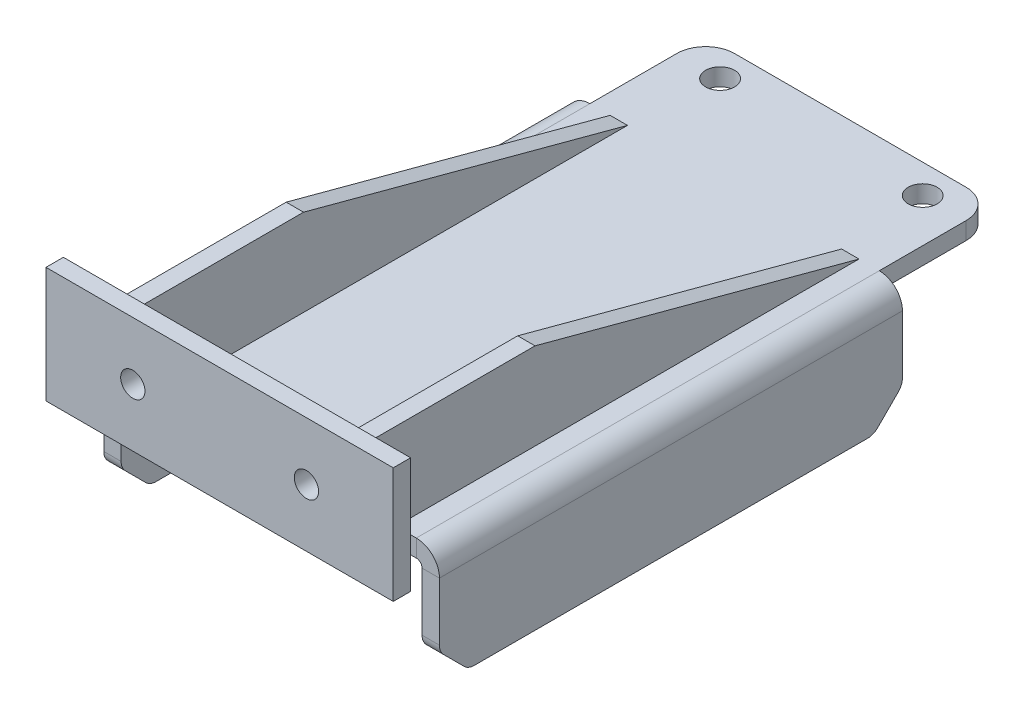
from build123d import *

# Parameters (mm, degrees)
ESBO_O1_W                 = 90
ESBO_O1_H                 = 100
RESSALTO_EXTRUS_O1_DEPTH  = 3
ESBO_O4_W                 = 20
ESBO_O4_H                 = 20
CORTE_EXTRUS_O1_DEPTH     = 3
DOBRA_START               = -30
DOBRA_ESBO_ADA1_DEPTH     = 80
DOBRA_ESBO_ADA1_2_DEPTH   = 80
DOBRA_ESBO_ADA2_DEPTH     = 80
DOBRA_ESBO_ADA2_2_DEPTH   = 80
FILETE1_R                 = 5
CHANFRO1_SIZE             = 5
FILETE2_R                 = 2.5
ESBO_O7_R                 = 2.5
CORTE_EXTRUS_O2_DEPTH     = 3
RESSALTO_EXTRUS_O2_DEPTH  = 21.5
ESBO_O9_W                 = 37
ESBO_O9_H                 = 15
CORTE_EXTRUS_O7_DEPTH     = 90
ESBO_O10_W                = 3
ESBO_O10_H                = 20
RESSALTO_EXTRUS_O3_DEPTH  = 30
FURO_ROSCADO_DE_M51_D     = 4.2
FURO_ROSCADO_DE_M51_DEPTH = 14
FURO_ROSCADO_DE_M51_TIP   = 1.2618073


# Read off the part's stored shape, not the designer's step: Dobra esboçada1, Dobra esboçada2
with BuildPart() as part:
    # Esboço1 → Ressalto-extrusão1 (new body)
    with BuildSketch(Plane(origin=(0, 0, 0), x_dir=(1, 0, 0), z_dir=(0, 1, 0))):
        Rectangle(ESBO_O1_W, ESBO_O1_H)
    extrude(amount=RESSALTO_EXTRUS_O1_DEPTH)

    # Esboço4 → Corte-extrusão1 (cut)
    with BuildSketch(Plane(origin=(0, 3, 0), x_dir=(1, 0, 0), z_dir=(0, 1, 0))):
        with Locations((-35, 40)):
            Rectangle(ESBO_O4_W, ESBO_O4_H)
        with Locations((35, 40)):
            Rectangle(ESBO_O4_W, ESBO_O4_H)
    extrude(amount=-CORTE_EXTRUS_O1_DEPTH, mode=Mode.SUBTRACT)

    # Dobra esboçada1 outline → Dobra esboçada1 (cut)
    with BuildSketch(Plane.XY.offset(DOBRA_START)):
        with BuildLine():
            Line((-45, 0), (-28.872983346, 0))
            ThreePointArc((-28.872983346, 0), (-27.449489743, 2.16227766), (-25, 3))
            Line((-25, 3), (-45, 3))
            Line((-45, 3), (-45, 0))
        make_face()
    extrude(amount=DOBRA_ESBO_ADA1_DEPTH, mode=Mode.SUBTRACT)

    # Dobra esbo_ada1 2 outline → Dobra esbo_ada1 2 (add)
    with BuildSketch(Plane.XY.offset(DOBRA_START)):
        with BuildLine():
            ThreePointArc((-28.872983346, 0), (-28.968118785, -0.49598283), (-29, -1))
            Line((-29, -1), (-29, -17.073009183))
            Line((-29, -17.073009183), (-26, -17.073009183))
            Line((-26, -17.073009183), (-26, -1))
            ThreePointArc((-26, -1), (-25.707106781, -0.292893219), (-25, 0))
            Line((-25, 0), (-28.872983346, 0))
        make_face()
    extrude(amount=DOBRA_ESBO_ADA1_2_DEPTH)

    # Dobra esboçada2 outline → Dobra esboçada2 (cut)
    with BuildSketch(Plane.XY.offset(DOBRA_START)):
        with BuildLine():
            ThreePointArc((25, 3), (27.449489743, 2.16227766), (28.872983346, 0))
            Line((28.872983346, 0), (45, 0))
            Line((45, 0), (45, 3))
            Line((45, 3), (25, 3))
        make_face()
    extrude(amount=DOBRA_ESBO_ADA2_DEPTH, mode=Mode.SUBTRACT)

    # Dobra esbo_ada2 2 outline → Dobra esbo_ada2 2 (add)
    with BuildSketch(Plane.XY.offset(DOBRA_START)):
        with BuildLine():
            Line((26, -1), (26, -17.073009183))
            Line((26, -17.073009183), (29, -17.073009183))
            Line((29, -17.073009183), (29, -1))
            ThreePointArc((29, -1), (28.968118785, -0.49598283), (28.872983346, 0))
            Line((28.872983346, 0), (25, 0))
            ThreePointArc((25, 0), (25.707106781, -0.292893219), (26, -1))
        make_face()
    extrude(amount=DOBRA_ESBO_ADA2_2_DEPTH)

    # Filete1
    filete1_edges = [part.edges().sort_by_distance(p)[0] for p in [
        (-25, 1.5, -50),
        (25, 1.5, -50),
    ]]
    fillet(filete1_edges, radius=FILETE1_R)

    # Chanfro1
    chanfro1_edges = [part.edges().sort_by_distance(p)[0] for p in [
        (27.5, -17.073009183, -30),
        (27.5, -17.073009183, 50),
        (-27.5, -17.073009183, -30),
        (-27.5, -17.073009183, 50),
    ]]
    chamfer(chanfro1_edges, length=CHANFRO1_SIZE)

    # Filete2
    filete2_edges = [part.edges().sort_by_distance(p)[0] for p in [
        (27.5, -12.073009183, 50),
        (27.5, -17.073009183, -25),
        (27.5, -17.073009183, 45),
        (-27.5, -17.073009183, -25),
        (-27.5, -17.073009183, 45),
        (-27.5, -12.073009183, 50),
        (27.5, -12.073009183, -30),
        (-27.5, -12.073009183, -30),
    ]]
    fillet(filete2_edges, radius=FILETE2_R)

    # Esboço7 → Corte-extrusão2 (cut)
    with BuildSketch(Plane(origin=(0, 3, 0), x_dir=(1, 0, 0), z_dir=(0, 1, 0))):
        with Locations(Location((-17.5, 45, 0), (0, 0, 270))):
            Circle(ESBO_O7_R)
        with Locations(Location((17.5, 45, 0), (0, 0, 270))):
            Circle(ESBO_O7_R)
    extrude(amount=-CORTE_EXTRUS_O2_DEPTH, mode=Mode.SUBTRACT)

    # Esboço8 → Ressalto-extrusão2 (add, symmetric)
    with BuildSketch(Plane(origin=(0, 0, 0), x_dir=(0, 0, -1), z_dir=(1, 0, 0))):
        Polygon((30, 3), (-25.980762114, 18), (-55.980762114, 18), (-55.980762114, 3), align=None)
    extrude(amount=RESSALTO_EXTRUS_O2_DEPTH, both=True)

    # Esboço9 → Corte-extrusão7 (cut)
    with BuildSketch(Plane.XY.offset(55.980762114)):
        with Locations((0, 10.5)):
            Rectangle(ESBO_O9_W, ESBO_O9_H)
    extrude(amount=-CORTE_EXTRUS_O7_DEPTH, mode=Mode.SUBTRACT)

    # Esboço10 → Ressalto-extrusão3 (add, symmetric)
    with BuildSketch(Plane(origin=(0, 0, 0), x_dir=(0, 0, -1), z_dir=(1, 0, 0))):
        with Locations((-57.480762114, 10.5)):
            Rectangle(ESBO_O10_W, ESBO_O10_H)
    extrude(amount=RESSALTO_EXTRUS_O3_DEPTH, both=True)

    # Furo roscado de M51
    with Locations(Plane.XY.offset(58.980762114)):
        with Locations((-15, 10.5), (15, 10.5)):
            Hole(FURO_ROSCADO_DE_M51_D / 2, depth=FURO_ROSCADO_DE_M51_DEPTH)
            with Locations((0, 0, -(FURO_ROSCADO_DE_M51_DEPTH + FURO_ROSCADO_DE_M51_TIP / 2))):  # 118° drill point
                Cone(0, FURO_ROSCADO_DE_M51_D / 2, FURO_ROSCADO_DE_M51_TIP, mode=Mode.SUBTRACT)


solid = part.part
